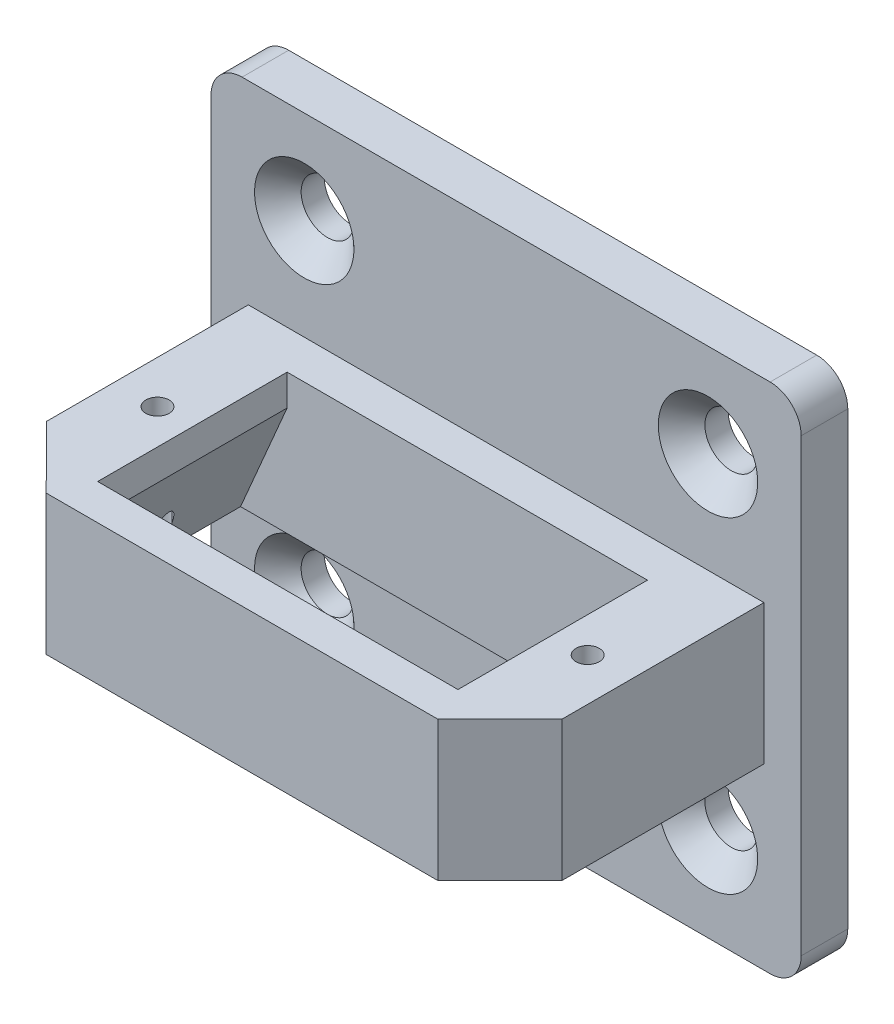
from build123d import *

# Parameters (mm, degrees)
SKETCH1_W                = 38
SKETCH1_H                = 33
SKETCH1_R                = 1.7
BOSS_EXTRUDE1_DEPTH      = 3
BOSS_EXTRUDE2_DEPTH      = 5
BOSS_EXTRUDE2_DEPTH_BACK = 4
SKETCH3_R                = 0.75
SKETCH3_W                = 23.2
SKETCH3_H                = 12.2
FILLET1_R                = 2
CHAMFER1_SIZE            = 1.5
CHAMFER2_SIZE            = 3
CHAMFER2_SIZE_2          = 7


with BuildPart() as part:
    # Sketch1 → Boss-Extrude1 (new body)
    with BuildSketch(Plane.XY):
        Rectangle(SKETCH1_W, SKETCH1_H)
        with Locations((-13, 10.5)):
            Circle(SKETCH1_R, mode=Mode.SUBTRACT)
        with Locations((13, 10.5)):
            Circle(SKETCH1_R, mode=Mode.SUBTRACT)
        with Locations((13, -10.5)):
            Circle(SKETCH1_R, mode=Mode.SUBTRACT)
        with Locations((-13, -10.5)):
            Circle(SKETCH1_R, mode=Mode.SUBTRACT)
    extrude(amount=BOSS_EXTRUDE1_DEPTH)

    # Sketch3 → Boss-Extrude2 (add, two sides: drawn at the far end of the back side and taken through both)
    with BuildSketch(Plane(origin=(0, 0, 0), x_dir=(-1, 0, 0), z_dir=(0, -1, 0)).offset(-BOSS_EXTRUDE2_DEPTH_BACK)):
        Polygon((16.6, -3), (16.6, -16), (12.612805852, -20), (-12.612805852, -20), (-16.6, -16), (-16.6, -3), align=None)
        with Locations(Location((-13.85, -11.6, 0), (0, 0, 90))):
            Circle(SKETCH3_R, mode=Mode.SUBTRACT)
        with Locations(Location((13.85, -11.6, 0), (0, 0, 90))):
            Circle(SKETCH3_R, mode=Mode.SUBTRACT)
        with Locations((0, -11.6)):
            Rectangle(SKETCH3_W, SKETCH3_H, mode=Mode.SUBTRACT)
    extrude(amount=BOSS_EXTRUDE2_DEPTH + BOSS_EXTRUDE2_DEPTH_BACK)

    # Fillet1
    fillet1_edges = [part.edges().sort_by_distance(p)[0] for p in [
        (19, -16.5, 1.5),
        (-19, -16.5, 1.5),
        (-19, 16.5, 1.5),
        (19, 16.5, 1.5),
    ]]
    fillet(fillet1_edges, radius=FILLET1_R)

    # Chamfer1
    chamfer1_edges = [part.edges().sort_by_distance(p)[0] for p in [
        (-14.7, 10.5, 3),
        (11.3, 10.5, 3),
        (11.3, -10.5, 3),
        (-14.7, -10.5, 3),
    ]]
    chamfer(chamfer1_edges, length=CHAMFER1_SIZE)

    # Chamfer2
    # the kernel refuses this chamfer: 7, 3 mm, written as the material it takes off along each edge
    with BuildSketch(Plane(origin=(-11.6, -5, 17.7), x_dir=(-0.9965941369752023, -0.08246287738523173, 0), z_dir=(0, 0, -1))) as chamfer2_piece_1:
        Polygon((CHAMFER2_SIZE * 0.996594136975, CHAMFER2_SIZE * 0.0824628773852), (-CHAMFER2_SIZE_2 * 0.0824628773852, CHAMFER2_SIZE_2 * 0.996594136975), (0, 0), align=None)
    extrude(amount=12.2, mode=Mode.SUBTRACT)


solid = part.part
